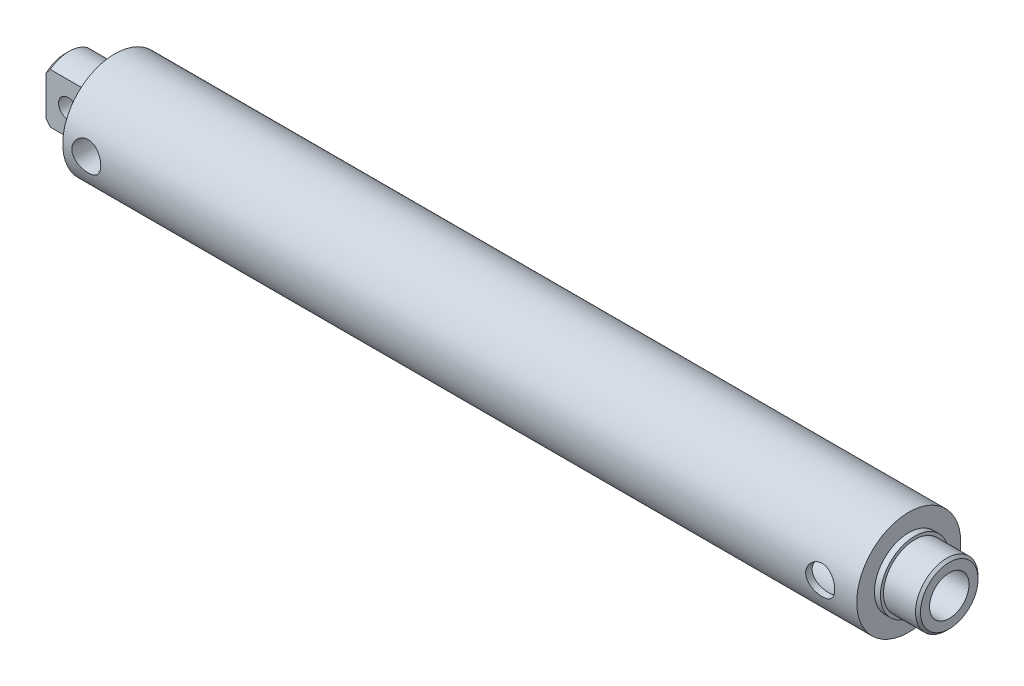
from build123d import *

# Parameters (mm, degrees)
SKETCH1_R                         = 26.416
BOSS_EXTRUDE1_DEPTH               = 201.549
SKETCH8_R                         = 17.4244
BOSS_EXTRUDE2_DEPTH               = 25.4
CUT_EXTRUDE1_START                = -22.352
CUT_EXTRUDE1_DEPTH                = 22.352
SKETCH16_R                        = 4.826
CUT_EXTRUDE2_DEPTH                = 232.290745898
BOSS_EXTRUDE3_START               = 20.574
SKETCH17_R                        = 17.4244
BOSS_EXTRUDE3_DEPTH               = 20.574
SKETCH20_R                        = 10.033
CUT_EXTRUDE3_DEPTH                = 23.749
SKETCH22_R                        = 23.241
CUT_EXTRUDE4_DEPTH                = 281.051
F_1_4_NPT_TAPPED_HOLE3_AT_2_COUNT = 2
F_1_4_NPT_TAPPED_HOLE3_AT_2_PITCH = 372.618


# Read off the part's stored shape, not the designer's step: 1-1/4-7 Machine Threads Stud1, 1-1/4-12 Machine Threads Stud1
with BuildPart() as part:
    # Sketch1 → Boss-Extrude1 (new, symmetric)
    with BuildSketch(Plane(origin=(0, 0, 0), x_dir=(0, 0, -1), z_dir=(1, 0, 0))):
        Circle(SKETCH1_R)
    extrude(amount=BOSS_EXTRUDE1_DEPTH, both=True)

    # Sketch8 → Boss-Extrude2 (add)
    with BuildSketch(Plane.ZY.offset(201.549)):
        Circle(SKETCH8_R)
    extrude(amount=BOSS_EXTRUDE2_DEPTH)

    # 1-1/4-7 Machine Threads Stud1 outline → 1-1/4-7 Machine Threads Stud1 (revolve, cut)
    with BuildSketch(Plane.YX):
        Polygon((13.71473, -226.949), (17.4244, -226.949), (17.4244, -204.597), (15.875, -204.597), (15.875, -224.78873), align=None)
    revolve(axis=Axis((0, 0, 0), (1, 0, 0)), mode=Mode.SUBTRACT)

    # Sketch15 → Cut-Extrude1 (cut)
    with BuildSketch(Plane.ZY.offset(226.949).offset(CUT_EXTRUDE1_START)):
        with BuildLine():
            Line((-9.525, 14.59054798), (-9.525, -14.59054798))
            ThreePointArc((-9.525, -14.59054798), (-17.4244, 0), (-9.525, 14.59054798))
        make_face()
        with BuildLine():
            Line((9.525, 14.59054798), (9.525, -14.59054798))
            ThreePointArc((9.525, -14.59054798), (17.4244, 0), (9.525, 14.59054798))
        make_face()
    extrude(amount=CUT_EXTRUDE1_DEPTH, mode=Mode.SUBTRACT)

    # Sketch16 → Cut-Extrude2 (cut, through all)
    with BuildSketch(Plane.XY.offset(9.525)):
        with Locations((-215.773, 0)):
            Circle(SKETCH16_R)
    extrude(amount=-CUT_EXTRUDE2_DEPTH, mode=Mode.SUBTRACT)

    # Sketch17 → Boss-Extrude3 (add)
    with BuildSketch(Plane(origin=(201.549, 0, 0), x_dir=(0, 0, -1), z_dir=(1, 0, 0)).offset(BOSS_EXTRUDE3_START)):
        Circle(SKETCH17_R)
    extrude(amount=-BOSS_EXTRUDE3_DEPTH)

    # Sketch20 → Cut-Extrude3 (cut)
    with BuildSketch(Plane(origin=(222.123, 0, 0), x_dir=(0, 0, -1), z_dir=(1, 0, 0))):
        Circle(SKETCH20_R)
    extrude(amount=-CUT_EXTRUDE3_DEPTH, mode=Mode.SUBTRACT)

    # Sketch22 → Cut-Extrude4 (cut)
    with BuildSketch(Plane(origin=(198.374, 0, 0), x_dir=(0, 0, -1), z_dir=(1, 0, 0))):
        Circle(SKETCH22_R)
    extrude(amount=-CUT_EXTRUDE4_DEPTH, mode=Mode.SUBTRACT)

    # Sketch26 → 1/4 NPT Tapped Hole3 (revolve, cut)
    with BuildSketch(Plane(origin=(-189.611, 0, 26.416), x_dir=(0, -1, 0), z_dir=(1, 0, 0))):
        Polygon((0, 0), (0, 34.299867279), (5.5626, 30.95752), (5.5626, 26.7208), (6.557980564, 26.7208), (7.3580371, 0), align=None)
    f_1_4_npt_tapped_hole3 = revolve(axis=Axis((-189.611, 0, 32.766), (0, 0, -1)), mode=Mode.SUBTRACT)

    # 1/4 NPT Tapped Hole3 at 2: 1/4 NPT Tapped Hole3 ×2
    with Locations(*[(i * F_1_4_NPT_TAPPED_HOLE3_AT_2_PITCH, 0, 0) for i in range(1, F_1_4_NPT_TAPPED_HOLE3_AT_2_COUNT)]):
        add(f_1_4_npt_tapped_hole3, mode=Mode.SUBTRACT)

    # 1-1/4-12 Machine Threads Stud1 outline → 1-1/4-12 Machine Threads Stud1 (revolve, cut)
    with BuildSketch(Plane.YX):
        Polygon((17.4244, 222.123), (14.61516, 222.123), (15.875, 220.86316), (15.875, 204.597), (17.4244, 204.597), align=None)
    revolve(axis=Axis((0, 0, 0), (1, 0, 0)), mode=Mode.SUBTRACT)


solid = part.part
